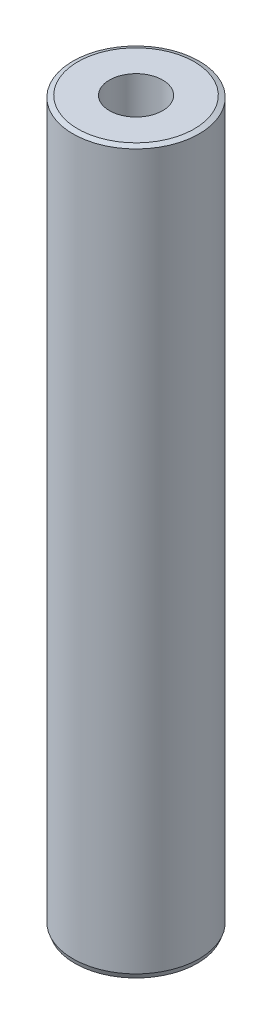
from build123d import *
from OCP.BRepFilletAPI import BRepFilletAPI_MakeChamfer

# Parameters (mm, degrees)
SKETCH1_R           = 52.5
BOSS_EXTRUDE1_DEPTH = 600
SKETCH2_R           = 22.129599989
CUT_EXTRUDE1_DEPTH  = 605.576297914
CHAMFER1_SIZE       = 1.53262716
CHAMFER1_SIZE2      = 4.063968385


with BuildPart() as part:
    # Sketch1 → Boss-Extrude1 (new body)
    with BuildSketch(Plane(origin=(0, 0, 0), x_dir=(1, 0, 0), z_dir=(0, 1, 0))):
        Circle(SKETCH1_R)
    extrude(amount=BOSS_EXTRUDE1_DEPTH)

    # Sketch2 → Cut-Extrude1 (cut, through all)
    with BuildSketch(Plane(origin=(0, 0, 0), x_dir=(1, 0, 0), z_dir=(0, 1, 0))):
        Circle(SKETCH2_R)
    extrude(amount=CUT_EXTRUDE1_DEPTH, mode=Mode.SUBTRACT)

    # Chamfer1: one chamfer whose edges measure the first distance from different faces: ONE call of the kernel's chamfer builder (chamfer() names one face for all edges)
    chamfer1_edges_1 = [part.edges().sort_by_distance(p)[0] for p in [
        (-52.5, 600, 0),
    ]]
    chamfer1_side_1 = [part.faces().sort_by_distance(p)[0] for p in [
        (-52.5, 300, 0),
    ]]
    chamfer1_edges_2 = [part.edges().sort_by_distance(p)[0] for p in [
        (-52.5, 0, 0),
    ]]
    chamfer1_side_2 = [part.faces().sort_by_distance(p)[0] for p in [
        (-51.01507576, 0, 0),
    ]]
    chamfer1 = BRepFilletAPI_MakeChamfer(part.part.solid().wrapped)
    for e in chamfer1_edges_1:
        chamfer1.Add(CHAMFER1_SIZE, CHAMFER1_SIZE2, e.wrapped, chamfer1_side_1[0].wrapped)  # the first distance lies on this face
    for e in chamfer1_edges_2:
        chamfer1.Add(CHAMFER1_SIZE, CHAMFER1_SIZE2, e.wrapped, chamfer1_side_2[0].wrapped)  # the first distance lies on this face
    add(Compound.cast(chamfer1.Shape()), mode=Mode.REPLACE)


solid = part.part
